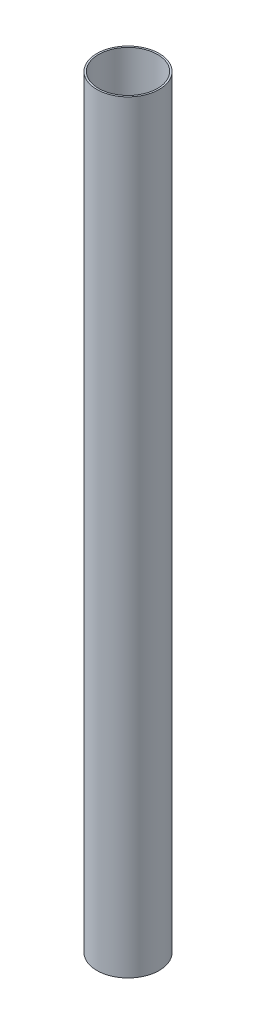
from build123d import *

# Parameters (mm, degrees)
SKETCH1_W = 1.4732
SKETCH1_H = 660.4


with BuildPart() as part:
    # Sketch1 → Revolve1 (revolve)
    with BuildSketch(Plane.XY):
        with Locations((26.2509, -289.938986199)):
            Rectangle(SKETCH1_W, SKETCH1_H)
    revolve(axis=Axis((0, 0, 0), (0, 1, 0)))


solid = part.part
